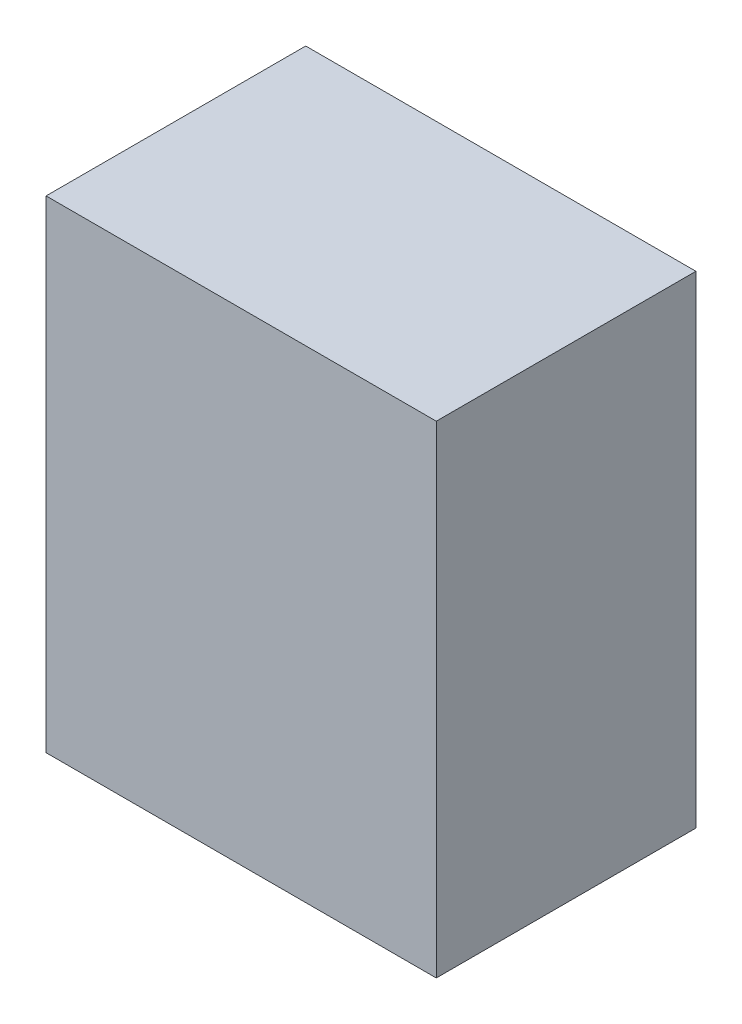
from build123d import *

# Parameters (mm, degrees)
SKETCH1_W           = 38.55430719
SKETCH1_H           = 47.647304168
BOSS_EXTRUDE1_DEPTH = 25.654


with BuildPart() as part:
    # Sketch1 → Boss-Extrude1 (new body)
    with BuildSketch(Plane.XY):
        with Locations((5.819518066, -1.273019577)):
            Rectangle(SKETCH1_W, SKETCH1_H)
    extrude(amount=BOSS_EXTRUDE1_DEPTH)


solid = part.part
